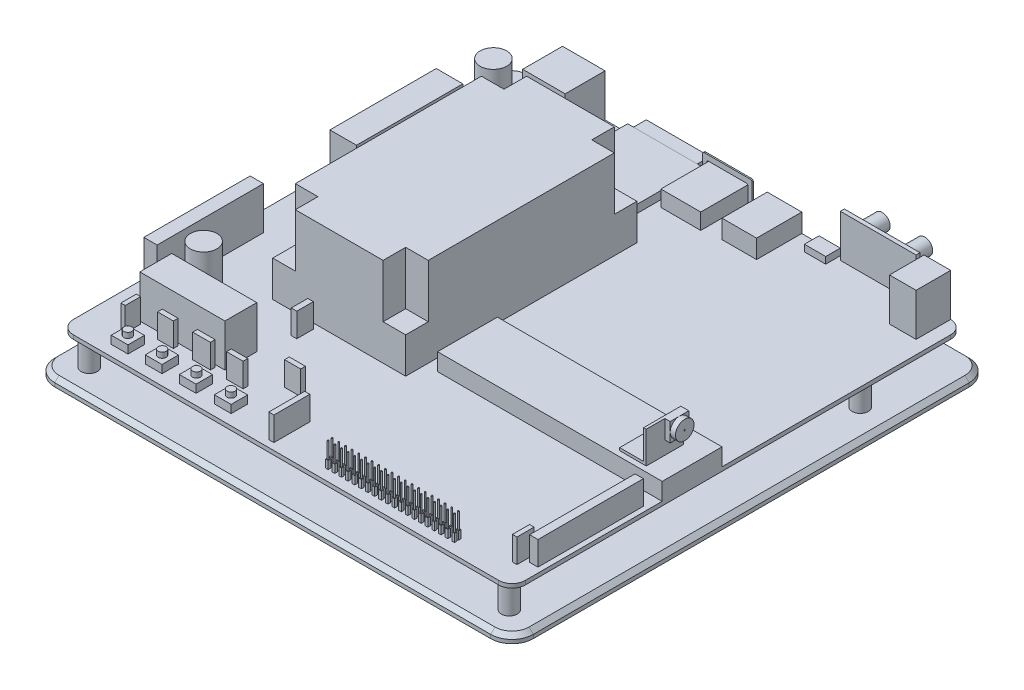
from build123d import *

# Parameters (mm, degrees)
RESSALTO_EXTRUS_O1_DEPTH  = 3
ESBO_O2_R                 = 3.5
RESSALTO_EXTRUS_O2_DEPTH  = 5
ESBO_O3_R                 = 3
RESSALTO_EXTRUS_O3_DEPTH  = 11
RESSALTO_EXTRUS_O4_DEPTH  = 1.5
ESBO_O5_W                 = 50
ESBO_O5_H                 = 87
RESSALTO_EXTRUS_O5_DEPTH  = 33.5
ESBO_O6_W                 = 8.5
ESBO_O6_H                 = 8.5
CORTE_EXTRUS_O1_DEPTH     = 20
ESBO_O7_W                 = 6.3
ESBO_O7_H                 = 6.2
RESSALTO_EXTRUS_O6_DEPTH  = 3
ESBO_O8_R                 = 1.5
RESSALTO_EXTRUS_O7_DEPTH  = 2
ESBO_O9_W                 = 1
ESBO_O9_H                 = 1
RESSALTO_EXTRUS_O8_DEPTH  = 3
ESBO_O10_R                = 0.25
RESSALTO_EXTRUS_O9_DEPTH  = 6
PADR_O_LINEAR1_COUNT      = 20
PADR_O_LINEAR1_PITCH      = 2.5
PADR_O_LINEAR1_COUNT_DIR2 = 2
PADR_O_LINEAR1_PITCH_DIR2 = 1.5
ESBO_O11_R                = 5
ESBO_O11_W                = 32
ESBO_O11_H                = 12
ESBO_O11_W_2              = 5
ESBO_O11_H_2              = 40
ESBO_O11_W_3              = 10
ESBO_O11_W_4              = 16
ESBO_O11_H_3              = 15
ESBO_O11_H_4              = 13
ESBO_O11_W_5              = 28.5
ESBO_O11_H_5              = 1.5
RESSALTO_EXTRUS_O10_DEPTH = 16
ESBO_O12_R                = 3
RESSALTO_EXTRUS_O11_DEPTH = 8
ESBO_O13_W                = 1.63158932
ESBO_O13_H                = 5.78472577
ESBO_O13_W_2              = 5.933052072
ESBO_O13_H_2              = 1.779915621
ESBO_O13_W_3              = 6.674683581
ESBO_O13_W_4              = 6.229704676
ESBO_O13_W_5              = 1.928241924
ESBO_O13_H_3              = 13.497693464
ESBO_O13_W_6              = 6.081378375
ESBO_O13_H_4              = 1.779915622
ESBO_O13_W_7              = 2.076568226
ESBO_O13_H_5              = 6.229704676
ESBO_O13_W_8              = 3.125695858
ESBO_O13_H_6              = 39.6558734
ESBO_O13_W_9              = 1.699808413
ESBO_O13_H_7              = 6.437326086
RESSALTO_EXTRUS_O12_DEPTH = 9
ESBO_O14_W                = 84.5
ESBO_O14_H                = 22.5
RESSALTO_EXTRUS_O13_DEPTH = 6.5
ESBO_O15_W                = 1
ESBO_O15_H                = 14
RESSALTO_EXTRUS_O14_DEPTH = 12
ESBO_O16_W                = 14
ESBO_O16_H                = 1
RESSALTO_EXTRUS_O15_DEPTH = 9
ESBO_O17_W                = 7
ESBO_O17_H                = 7
RESSALTO_EXTRUS_O16_DEPTH = 2
ESBO_O18_R                = 3.5
RESSALTO_EXTRUS_O17_DEPTH = 2
ESBO_O19_R                = 0.35
ESBO_O19_R_2              = 0.25
CORTE_EXTRUS_O2_DEPTH     = 0.2
RESSALTO_EXTRUS_O18_DEPTH = 3
ESBO_O21_W                = 24
ESBO_O21_H                = 0.2
CORTE_EXTRUS_O3_DEPTH     = 5
ESBO_O22_W                = 15
ESBO_O22_H                = 18
RESSALTO_EXTRUS_O19_DEPTH = 6
ESBO_O23_W                = 13
ESBO_O23_H                = 17
RESSALTO_EXTRUS_O20_DEPTH = 7
ESBO_O24_W                = 8
ESBO_O24_H                = 5.5
RESSALTO_EXTRUS_O21_DEPTH = 2.5
ESBO_O25_W                = 10
ESBO_O25_H                = 0.5
CORTE_EXTRUS_O4_DEPTH     = 8.5
RESSALTO_EXTRUS_O22_DEPTH = 0.5
ESBO_O27_W                = 12.6
ESBO_O27_H                = 6.6
ESBO_O27_W_2              = 10.6
ESBO_O27_H_2              = 1.5
CORTE_EXTRUS_O5_DEPTH     = 10
CORTE_EXTRUS_O6_DEPTH     = 4
CHANFRO1_SIZE             = 1.6


with BuildPart() as part:
    # Esboço1 → Ressalto-extrusão1 (new body)
    with BuildSketch(Plane(origin=(0, 0, 0), x_dir=(1, 0, 0), z_dir=(0, 1, 0))):
        with BuildLine():
            Line((82, -90), (-82, -90))
            ThreePointArc((-82, -90), (-87.656854249, -87.656854249), (-90, -82))
            Line((-90, -82), (-90, 82))
            ThreePointArc((-90, 82), (-87.656854249, 87.656854249), (-82, 90))
            Line((-82, 90), (82, 90))
            ThreePointArc((82, 90), (87.656854249, 87.656854249), (90, 82))
            Line((90, 82), (90, -82))
            ThreePointArc((90, -82), (87.656854249, -87.656854249), (82, -90))
        make_face()
    extrude(amount=RESSALTO_EXTRUS_O1_DEPTH)

    # Esboço2 → Ressalto-extrusão2 (add)
    with BuildSketch(Plane(origin=(0, 0, 0), x_dir=(-1, 0, 0), z_dir=(0, -1, 0))):
        with Locations((79, -62)):
            Circle(ESBO_O2_R)
        with Locations((-79, -62)):
            Circle(ESBO_O2_R)
        with Locations((-79, 62)):
            Circle(ESBO_O2_R)
        with Locations((79, 62)):
            Circle(ESBO_O2_R)
    extrude(amount=RESSALTO_EXTRUS_O2_DEPTH)

    # Esboço3 → Ressalto-extrusão3 (add)
    with BuildSketch(Plane(origin=(0, 3, 0), x_dir=(1, 0, 0), z_dir=(0, 1, 0))):
        with Locations((-79, -80)):
            Circle(ESBO_O3_R)
        with Locations((-79, 75)):
            Circle(ESBO_O3_R)
        with Locations((79, 52)):
            Circle(ESBO_O3_R)
        with Locations((79, -80)):
            Circle(ESBO_O3_R)
    extrude(amount=RESSALTO_EXTRUS_O3_DEPTH)

    # Esboço4 → Ressalto-extrusão4 (add)
    with BuildSketch(Plane(origin=(0, 14, 0), x_dir=(1, 0, 0), z_dir=(0, 1, 0))):
        with BuildLine():
            Line((-80, 85), (80, 85))
            ThreePointArc((80, 85), (83.535533906, 83.535533906), (85, 80))
            Line((85, 80), (85, -80))
            ThreePointArc((85, -80), (83.535533906, -83.535533906), (80, -85))
            Line((80, -85), (-80, -85))
            ThreePointArc((-80, -85), (-83.535533906, -83.535533906), (-85, -80))
            Line((-85, -80), (-85, 80))
            ThreePointArc((-85, 80), (-83.535533906, 83.535533906), (-80, 85))
        make_face()
    extrude(amount=RESSALTO_EXTRUS_O4_DEPTH)

    # Esboço5 → Ressalto-extrusão5 (add)
    with BuildSketch(Plane(origin=(0, 15.5, 0), x_dir=(1, 0, 0), z_dir=(0, 1, 0))):
        with Locations((-29, 7.5)):
            Rectangle(ESBO_O5_W, ESBO_O5_H)
    extrude(amount=RESSALTO_EXTRUS_O5_DEPTH)

    # Esboço6 → Corte-extrusão1 (cut)
    with BuildSketch(Plane(origin=(0, 49, 0), x_dir=(1, 0, 0), z_dir=(0, 1, 0))):
        with Locations((-49.75, -31.75)):
            Rectangle(ESBO_O6_W, ESBO_O6_H)
        with Locations((-8.25, -31.75)):
            Rectangle(ESBO_O6_W, ESBO_O6_H)
        with Locations((-8.25, 46.75)):
            Rectangle(ESBO_O6_W, ESBO_O6_H)
        with Locations((-49.75, 46.75)):
            Rectangle(ESBO_O6_W, ESBO_O6_H)
    extrude(amount=-CORTE_EXTRUS_O1_DEPTH, mode=Mode.SUBTRACT)

    # Esboço7 → Ressalto-extrusão6 (add)
    with BuildSketch(Plane(origin=(0, 15.5, 0), x_dir=(1, 0, 0), z_dir=(0, 1, 0))):
        with Locations((-27.8, -77.9)):
            Rectangle(ESBO_O7_W, ESBO_O7_H)
        with Locations((-66.6, -77.9)):
            Rectangle(ESBO_O7_W, ESBO_O7_H)
        with Locations((-53.8, -77.9)):
            Rectangle(ESBO_O7_W, ESBO_O7_H)
        with Locations((-41, -77.9)):
            Rectangle(ESBO_O7_W, ESBO_O7_H)
    extrude(amount=RESSALTO_EXTRUS_O6_DEPTH)

    # Esboço8 → Ressalto-extrusão7 (add)
    with BuildSketch(Plane(origin=(0, 18.5, 0), x_dir=(1, 0, 0), z_dir=(0, 1, 0))):
        with Locations((-66.6, -77.9)):
            Circle(ESBO_O8_R)
        with Locations((-53.7, -77.9)):
            Circle(ESBO_O8_R)
        with Locations((-40.8, -77.9)):
            Circle(ESBO_O8_R)
        with Locations((-27.75, -77.95)):
            Circle(ESBO_O8_R)
    extrude(amount=RESSALTO_EXTRUS_O7_DEPTH)

    # Esboço9 → Ressalto-extrusão8 (add)
    with BuildSketch(Plane(origin=(0, 15.5, 0), x_dir=(1, 0, 0), z_dir=(0, 1, 0))):
        with Locations((11.35, -80.5)):
            Rectangle(ESBO_O9_W, ESBO_O9_H)
    ressalto_extrus_o8 = extrude(amount=RESSALTO_EXTRUS_O8_DEPTH)

    # Esboço10 → Ressalto-extrusão9 (add)
    with BuildSketch(Plane(origin=(0, 18.5, 0), x_dir=(1, 0, 0), z_dir=(0, 1, 0))):
        with Locations((11.35, -80.5)):
            Circle(ESBO_O10_R)
    ressalto_extrus_o9 = extrude(amount=RESSALTO_EXTRUS_O9_DEPTH)

    # Padrão linear1: Ressalto-extrusão8, Ressalto-extrus_o9 20 × 2
    with Locations(*[(i * PADR_O_LINEAR1_PITCH, 0, -j * PADR_O_LINEAR1_PITCH_DIR2) for i in range(PADR_O_LINEAR1_COUNT) for j in range(PADR_O_LINEAR1_COUNT_DIR2) if (i, j) != (0, 0)]):
        add(ressalto_extrus_o8)
        add(ressalto_extrus_o9)

    # Esboço11 → Ressalto-extrusão10 (add)
    with BuildSketch(Plane(origin=(0, 15.5, 0), x_dir=(1, 0, 0), z_dir=(0, 1, 0))):
        with Locations((-70, -46)):
            Circle(ESBO_O11_R)
        with Locations((-75, 68)):
            Circle(ESBO_O11_R)
        with Locations((-55.996597933, -62)):
            Rectangle(ESBO_O11_W, ESBO_O11_H)
        with Locations((-80, -36)):
            Rectangle(ESBO_O11_W_2, ESBO_O11_H_2)
        with Locations((-77.5, 34)):
            Rectangle(ESBO_O11_W_3, ESBO_O11_H_2)
        with Locations((-58, 77.5)):
            Rectangle(ESBO_O11_W_4, ESBO_O11_H_3)
        with Locations((75, 78.5)):
            Rectangle(ESBO_O11_W_3, ESBO_O11_H_4)
        with Locations((54.25, 84.25)):
            Rectangle(ESBO_O11_W_5, ESBO_O11_H_5)
    extrude(amount=RESSALTO_EXTRUS_O10_DEPTH)

    # Esboço12 → Ressalto-extrusão11 (add)
    with BuildSketch(Plane(origin=(0, 0, -85), x_dir=(-1, 0, 0), z_dir=(0, 0, -1))):
        with Locations((-62.25, 26.5)):
            Circle(ESBO_O12_R)
        with Locations((-46.25, 26.5)):
            Circle(ESBO_O12_R)
    extrude(amount=RESSALTO_EXTRUS_O11_DEPTH)

    # Esboço13 → Ressalto-extrusão12 (add)
    with BuildSketch(Plane(origin=(0, 15.5, 0), x_dir=(1, 0, 0), z_dir=(0, 1, 0))):
        with Locations((-71.610074729, -71.799389553)):
            Rectangle(ESBO_O13_W, ESBO_O13_H)
        with Locations((-59.669807433, -69.796984479)):
            Rectangle(ESBO_O13_W_2, ESBO_O13_H_2)
        with Locations((-46.097950818, -69.796984479)):
            Rectangle(ESBO_O13_W_3, ESBO_O13_H_2)
        with Locations((-33.564378314, -69.796984479)):
            Rectangle(ESBO_O13_W_4, ESBO_O13_H_2)
        with Locations((-8.126417554, -75.6558734)):
            Rectangle(ESBO_O13_W_5, ESBO_O13_H_3)
        with Locations((-20.140848001, -61.490711577)):
            Rectangle(ESBO_O13_W_6, ESBO_O13_H_4)
        with Locations((-37.717514765, -41.170008229)):
            Rectangle(ESBO_O13_W_7, ESBO_O13_H_5)
        with Locations((81.512220505, -53.483128012)):
            Rectangle(ESBO_O13_W_8, ESBO_O13_H_6)
        with Locations((77.452286259, -73.22538484)):
            Rectangle(ESBO_O13_W_9, ESBO_O13_H_7)
    extrude(amount=RESSALTO_EXTRUS_O12_DEPTH)

    # Esboço14 → Ressalto-extrusão13 (add)
    with BuildSketch(Plane(origin=(0, 15.5, 0), x_dir=(1, 0, 0), z_dir=(0, 1, 0))):
        with Locations((42.75, -17.25)):
            Rectangle(ESBO_O14_W, ESBO_O14_H)
    extrude(amount=RESSALTO_EXTRUS_O13_DEPTH)

    # Esboço15 → Ressalto-extrusão14 (add)
    with BuildSketch(Plane(origin=(0, 22, 0), x_dir=(1, 0, 0), z_dir=(0, 1, 0))):
        with Locations((76.5, -19.5)):
            Rectangle(ESBO_O15_W, ESBO_O15_H)
    extrude(amount=RESSALTO_EXTRUS_O14_DEPTH)

    # Esboço16 → Ressalto-extrusão15 (add)
    with BuildSketch(Plane.ZY.offset(-76)):
        with Locations((19.5, 22.5)):
            Rectangle(ESBO_O16_W, ESBO_O16_H)
    extrude(amount=RESSALTO_EXTRUS_O15_DEPTH)

    # Esboço17 → Ressalto-extrusão16 (add)
    with BuildSketch(Plane(origin=(77, 0, 0), x_dir=(0, 0, -1), z_dir=(1, 0, 0))):
        with Locations((-16, 30.5)):
            Rectangle(ESBO_O17_W, ESBO_O17_H)
    extrude(amount=RESSALTO_EXTRUS_O16_DEPTH)

    # Esboço18 → Ressalto-extrusão17 (add)
    with BuildSketch(Plane(origin=(79, 0, 0), x_dir=(0, 0, -1), z_dir=(1, 0, 0))):
        with Locations((-16, 30.5)):
            Circle(ESBO_O18_R)
    extrude(amount=RESSALTO_EXTRUS_O17_DEPTH)

    # Esboço19 → Corte-extrusão2 (cut)
    with BuildSketch(Plane(origin=(81, 0, 0), x_dir=(0, 0, -1), z_dir=(1, 0, 0))):
        with Locations((-16, 30.5)):
            Circle(ESBO_O19_R)
        with Locations((-16, 30.5)):
            Circle(ESBO_O19_R_2, mode=Mode.SUBTRACT)
    extrude(amount=-CORTE_EXTRUS_O2_DEPTH, mode=Mode.SUBTRACT)

    # Esboço20 → Ressalto-extrusão18 (add)
    with BuildSketch(Plane(origin=(0, 15.5, 0), x_dir=(1, 0, 0), z_dir=(0, 1, 0))):
        Polygon((-39.5, 85), (-41.5, 85), (-41.5, 56), (-13.5, 56), (-13.5, 85), (-15.5, 85), (-15.5, 90), (-39.5, 90), align=None)
    extrude(amount=RESSALTO_EXTRUS_O18_DEPTH)

    # Esboço21 → Corte-extrusão3 (cut)
    with BuildSketch(Plane(origin=(0, 0, -90), x_dir=(-1, 0, 0), z_dir=(0, 0, -1))):
        with Locations((27.5, 15.6)):
            Rectangle(ESBO_O21_W, ESBO_O21_H)
        with Locations((27.5, 18.4)):
            Rectangle(ESBO_O21_W, ESBO_O21_H)
    extrude(amount=-CORTE_EXTRUS_O3_DEPTH, mode=Mode.SUBTRACT)

    # Esboço22 → Ressalto-extrusão19 (add)
    with BuildSketch(Plane(origin=(0, 15.5, 0), x_dir=(1, 0, 0), z_dir=(0, 1, 0))):
        with Locations((-3.5, 76)):
            Rectangle(ESBO_O22_W, ESBO_O22_H)
    extrude(amount=RESSALTO_EXTRUS_O19_DEPTH)

    # Esboço23 → Ressalto-extrusão20 (add)
    with BuildSketch(Plane(origin=(0, 15.5, 0), x_dir=(1, 0, 0), z_dir=(0, 1, 0))):
        with Locations((17.5, 76.5)):
            Rectangle(ESBO_O23_W, ESBO_O23_H)
    extrude(amount=RESSALTO_EXTRUS_O20_DEPTH)

    # Esboço24 → Ressalto-extrusão21 (add)
    with BuildSketch(Plane(origin=(0, 15.5, 0), x_dir=(1, 0, 0), z_dir=(0, 1, 0))):
        with Locations((34.5, 82.25)):
            Rectangle(ESBO_O24_W, ESBO_O24_H)
    extrude(amount=RESSALTO_EXTRUS_O21_DEPTH)

    # Esboço25 → Corte-extrusão4 (cut)
    with BuildSketch(Plane(origin=(0, 0, -85), x_dir=(-1, 0, 0), z_dir=(0, 0, -1))):
        Polygon((-3.5, 20), (10.5, 20), (10.5, 17), (9, 15.5), (-2, 15.5), (-3.5, 17), align=None)
        with Locations((3.5, 17.75)):
            Rectangle(ESBO_O25_W, ESBO_O25_H, mode=Mode.SUBTRACT)
    extrude(amount=-CORTE_EXTRUS_O4_DEPTH, mode=Mode.SUBTRACT)

    # Esboço26 → Ressalto-extrusão22 (add)
    with BuildSketch(Plane(origin=(0, 0, -85), x_dir=(-1, 0, 0), z_dir=(0, 0, -1))):
        with BuildLine():
            Line((-4.2, 15.5), (-4.2, 21.5))
            ThreePointArc((-4.2, 21.5), (-4.053553391, 21.853553391), (-3.7, 22))
            Line((-3.7, 22), (10.7, 22))
            ThreePointArc((10.7, 22), (11.053553391, 21.853553391), (11.2, 21.5))
            Line((11.2, 21.5), (11.2, 15.5))
            Line((11.2, 15.5), (12.75, 15.5))
            Line((12.75, 15.5), (12.75, 23.5))
            ThreePointArc((12.75, 23.5), (12.603553391, 23.853553391), (12.25, 24))
            Line((12.25, 24), (-5.25, 24))
            ThreePointArc((-5.25, 24), (-5.603553391, 23.853553391), (-5.75, 23.5))
            Line((-5.75, 23.5), (-5.75, 15.5))
            Line((-5.75, 15.5), (-4.2, 15.5))
        make_face()
    extrude(amount=-RESSALTO_EXTRUS_O22_DEPTH)

    # Esboço27 → Corte-extrusão5 (cut)
    with BuildSketch(Plane(origin=(0, 0, -85), x_dir=(-1, 0, 0), z_dir=(0, 0, -1))):
        with Locations((-17.5, 19)):
            Rectangle(ESBO_O27_W, ESBO_O27_H)
        with Locations((-17.5, 20.55)):
            Rectangle(ESBO_O27_W_2, ESBO_O27_H_2, mode=Mode.SUBTRACT)
    extrude(amount=-CORTE_EXTRUS_O5_DEPTH, mode=Mode.SUBTRACT)

    # Esboço28 → Corte-extrusão6 (cut)
    with BuildSketch(Plane(origin=(0, 0, -85), x_dir=(-1, 0, 0), z_dir=(0, 0, -1))):
        with BuildLine():
            Line((-37.3, 17.8), (-31.7, 17.8))
            ThreePointArc((-31.7, 17.8), (-30.992893219, 17.507106781), (-30.7, 16.8))
            Line((-30.7, 16.8), (-30.7, 16.7))
            ThreePointArc((-30.7, 16.7), (-30.992893219, 15.992893219), (-31.7, 15.7))
            Line((-31.7, 15.7), (-37.3, 15.7))
            ThreePointArc((-37.3, 15.7), (-38.007106781, 15.992893219), (-38.3, 16.7))
            Line((-38.3, 16.7), (-38.3, 16.8))
            ThreePointArc((-38.3, 16.8), (-38.007106781, 17.507106781), (-37.3, 17.8))
        make_face()
    extrude(amount=-CORTE_EXTRUS_O6_DEPTH, mode=Mode.SUBTRACT)

    # Chanfro1
    chanfro1_edges = [part.edges().sort_by_distance(p)[0] for p in [
        (90, 3, 0),
        (87.656854249, 3, -87.656854249),
        (87.656854249, 3, 87.656854249),
        (0, 3, -90),
        (0, 3, 90),
        (-87.656854249, 3, -87.656854249),
        (-87.656854249, 3, 87.656854249),
        (-90, 3, 0),
    ]]
    chamfer(chanfro1_edges, length=CHANFRO1_SIZE)


solid = part.part
